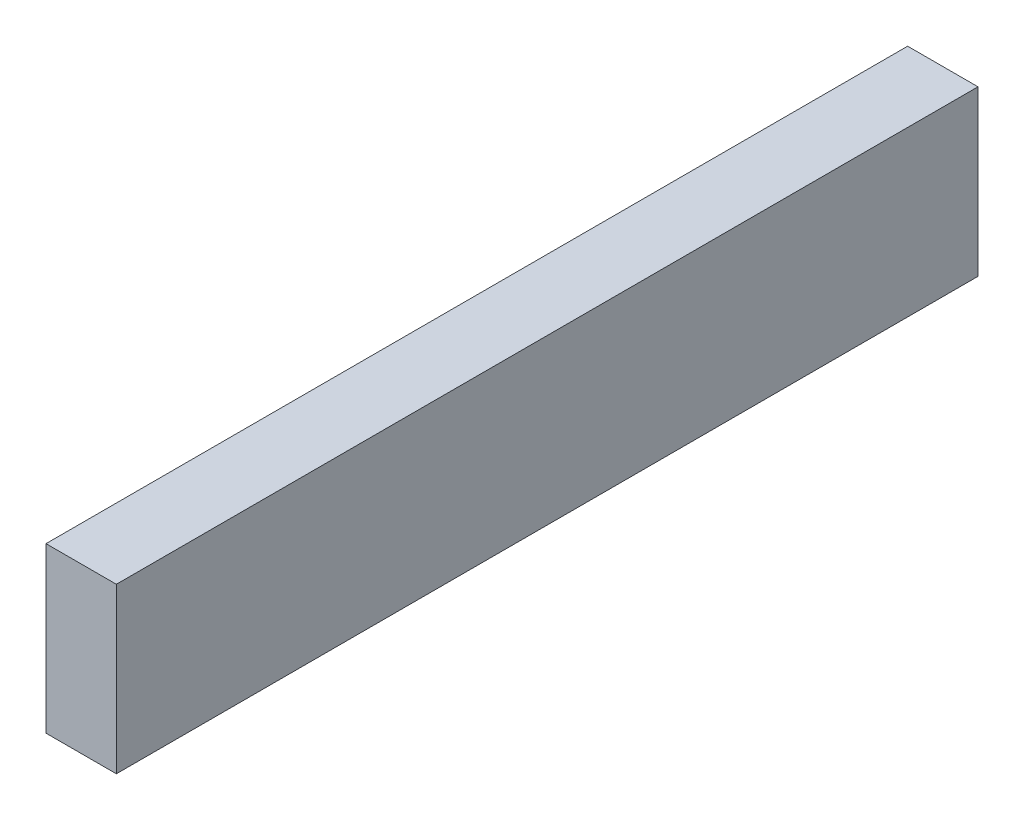
from build123d import *

# Parameters (mm, degrees)
SKETCH1_W           = 38.1
SKETCH1_H           = 88.9
BOSS_EXTRUDE1_DEPTH = 466.598


with BuildPart() as part:
    # Sketch1 → Boss-Extrude1 (new body)
    with BuildSketch(Plane.XY):
        with Locations((19.05, 44.45)):
            Rectangle(SKETCH1_W, SKETCH1_H)
    extrude(amount=BOSS_EXTRUDE1_DEPTH)


solid = part.part
